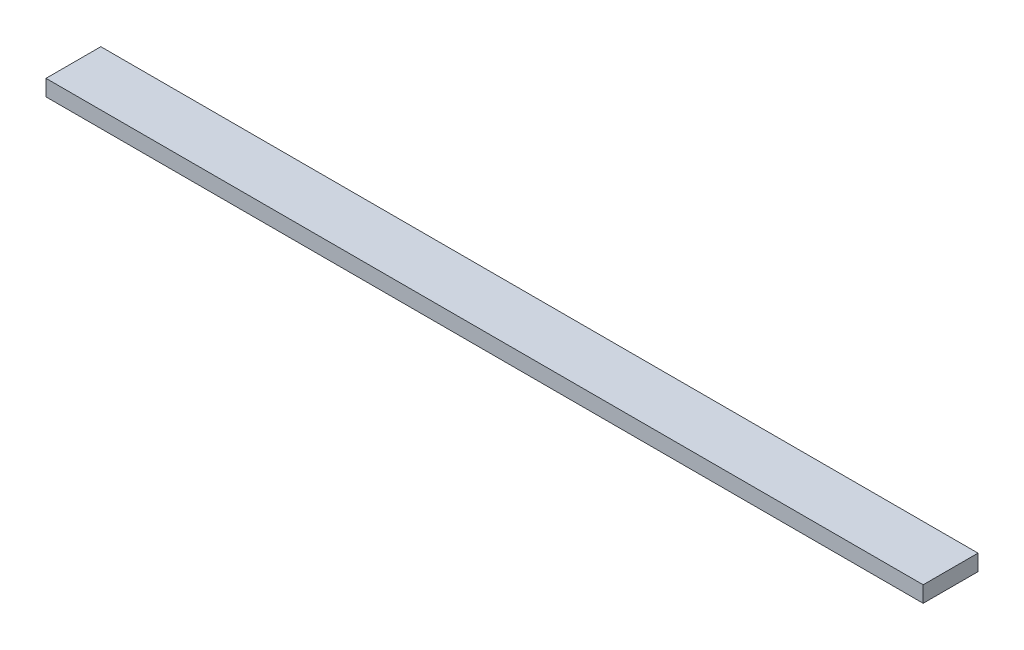
from build123d import *

# Parameters (mm, degrees)
SKETCH1_W           = 304.8
SKETCH1_H           = 19.05
BOSS_EXTRUDE1_DEPTH = 5.588


with BuildPart() as part:
    # Sketch1 → Boss-Extrude1 (new body)
    with BuildSketch(Plane(origin=(0, 0, 0), x_dir=(1, 0, 0), z_dir=(0, 1, 0))):
        Rectangle(SKETCH1_W, SKETCH1_H)
    extrude(amount=BOSS_EXTRUDE1_DEPTH)


solid = part.part
